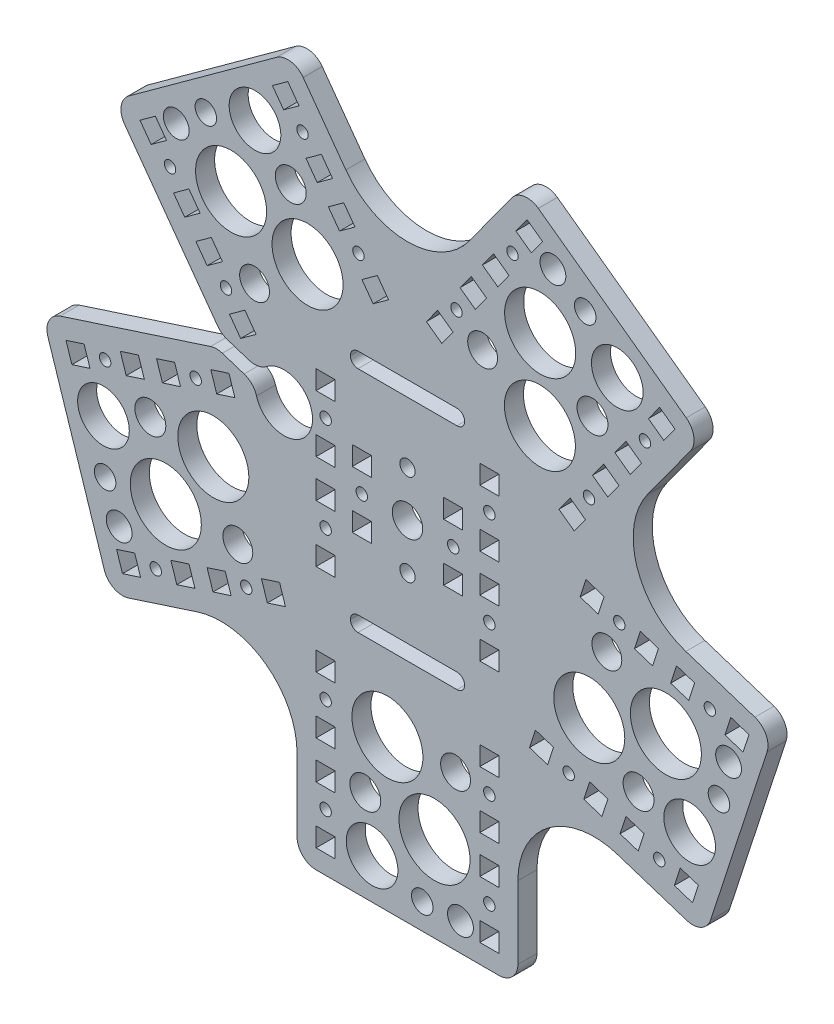
from build123d import *

# Parameters (mm, degrees)
ESQUISSE1_R        = 4
ESQUISSE1_R_2      = 2
ESQUISSE1_R_3      = 9.330569086
ESQUISSE1_R_4      = 6.785078522
ESQUISSE1_R_5      = 4.062418715
ESQUISSE1_R_6      = 3.923995784
ESQUISSE1_R_7      = 2.830029206
ESQUISSE1_R_8      = 3.391581878
ESQUISSE1_R_9      = 1.5
ESQUISSE1_W        = 30
ESQUISSE1_H        = 4
ESQUISSE1_W_2      = 5
ESQUISSE1_H_2      = 5
BOSS_EXTRU_1_DEPTH = 5
CONG_1_R           = 2
CONG_2_R           = 20
CONG_3_R           = 5


with BuildPart() as part:
    # Esquisse1 → Boss.-Extru.1 (new body)
    with BuildSketch(Plane.XY):
        with BuildLine():
            Line((-29, -91.5), (29, -91.5))
            Line((29, -91.5), (29, -39.915075694))
            Line((29, -39.915075694), (78.060178404, -55.855693958))
            Line((78.060178404, -55.855693958), (95.983164078, -0.694416013))
            Line((95.983164078, -0.694416013), (46.922985674, 15.246202251))
            Line((46.922985674, 15.246202251), (77.243843422, 56.979282669))
            Line((77.243843422, 56.979282669), (30.320857748, 91.070827302))
            Line((30.320857748, 91.070827302), (0, 49.337746884))
            Line((0, 49.337746884), (-30.320857748, 91.070827302))
            Line((-30.320857748, 91.070827302), (-77.243843422, 56.979282669))
            Line((-77.243843422, 56.979282669), (-48.922985674, 17.998966092))
            Line((-48.922985674, 17.998966092), (-38.696499555, 14.676179329))
            ThreePointArc((-38.696499555, 14.676179329), (-25.306977392, 8.222735407), (-39.932567532, 10.871953264))
            Line((-39.932567532, 10.871953264), (-50.159053651, 14.194740027))
            Line((-50.159053651, 14.194740027), (-95.983164078, -0.694416013))
            Line((-95.983164078, -0.694416013), (-78.060178404, -55.855693958))
            Line((-78.060178404, -55.855693958), (-29, -39.915075694))
            Line((-29, -39.915075694), (-29, -91.5))
        make_face()
        Circle(ESQUISSE1_R, mode=Mode.SUBTRACT)
        with Locations((0, -12)):
            Circle(ESQUISSE1_R_2, mode=Mode.SUBTRACT)
        with Locations((0, 12)):
            Circle(ESQUISSE1_R_2, mode=Mode.SUBTRACT)
        with Locations((-5.271266867, -51.905701943)):
            Circle(ESQUISSE1_R_3, mode=Mode.SUBTRACT)
        with Locations((7.090608048, -69.04841246)):
            Circle(ESQUISSE1_R_3, mode=Mode.SUBTRACT)
        with Locations((-9.300828303, -80.932203815)):
            Circle(ESQUISSE1_R_4, mode=Mode.SUBTRACT)
        with Locations((-11.076567241, -67.409268825)):
            Circle(ESQUISSE1_R_5, mode=Mode.SUBTRACT)
        with Locations((12.622717816, -50.949534823)):
            Circle(ESQUISSE1_R_6, mode=Mode.SUBTRACT)
        with Locations((3.880618429, -84.756872296)):
            Circle(ESQUISSE1_R_7, mode=Mode.SUBTRACT)
        with Locations((13.920373194, -84.142193433)):
            Circle(ESQUISSE1_R_8, mode=Mode.SUBTRACT)
        with Locations((-75.722349475, -39.24042935)):
            Circle(ESQUISSE1_R_8, mode=Mode.SUBTRACT)
        with Locations((-79.409398655, -29.882001374)):
            Circle(ESQUISSE1_R_7, mode=Mode.SUBTRACT)
        with Locations((-79.845213823, -16.163813006)):
            Circle(ESQUISSE1_R_4, mode=Mode.SUBTRACT)
        with Locations((-67.532871892, -10.296168192)):
            Circle(ESQUISSE1_R_5, mode=Mode.SUBTRACT)
        with Locations((-50.99416711, -11.026471302)):
            Circle(ESQUISSE1_R_3, mode=Mode.SUBTRACT)
        with Locations((-44.555252775, -27.749190148)):
            Circle(ESQUISSE1_R_6, mode=Mode.SUBTRACT)
        with Locations((-63.477824223, -28.080701873)):
            Circle(ESQUISSE1_R_3, mode=Mode.SUBTRACT)
        with Locations((-60.719358878, 59.890274362)):
            Circle(ESQUISSE1_R_8, mode=Mode.SUBTRACT)
        with Locations((-52.958325824, 66.288779796)):
            Circle(ESQUISSE1_R_7, mode=Mode.SUBTRACT)
        with Locations((-40.046227679, 70.942417989)):
            Circle(ESQUISSE1_R_4, mode=Mode.SUBTRACT)
        with Locations((-30.661042946, 61.045886928)):
            Circle(ESQUISSE1_R_5, mode=Mode.SUBTRACT)
        with Locations((-26.244861635, 45.090967902)):
            Circle(ESQUISSE1_R_3, mode=Mode.SUBTRACT)
        with Locations((-40.159378408, 33.799592151)):
            Circle(ESQUISSE1_R_6, mode=Mode.SUBTRACT)
        with Locations((-46.322060949, 51.693584275)):
            Circle(ESQUISSE1_R_3, mode=Mode.SUBTRACT)
        with Locations((38.195721914, 76.254654501)):
            Circle(ESQUISSE1_R_8, mode=Mode.SUBTRACT)
        with Locations((46.679353309, 70.85072036)):
            Circle(ESQUISSE1_R_7, mode=Mode.SUBTRACT)
        with Locations((55.095283997, 60.008638567)):
            Circle(ESQUISSE1_R_4, mode=Mode.SUBTRACT)
        with Locations((48.583305221, 48.024601187)):
            Circle(ESQUISSE1_R_5, mode=Mode.SUBTRACT)
        with Locations((34.773950589, 38.894222052)):
            Circle(ESQUISSE1_R_3, mode=Mode.SUBTRACT)
        with Locations((19.735391951, 48.638486903)):
            Circle(ESQUISSE1_R_6, mode=Mode.SUBTRACT)
        with Locations((34.849216127, 60.029093955)):
            Circle(ESQUISSE1_R_3, mode=Mode.SUBTRACT)
        with Locations((84.325613245, -12.76230608)):
            Circle(ESQUISSE1_R_8, mode=Mode.SUBTRACT)
        with Locations((81.807752742, -22.500626486)):
            Circle(ESQUISSE1_R_7, mode=Mode.SUBTRACT)
        with Locations((74.096985808, -33.855039736)):
            Circle(ESQUISSE1_R_4, mode=Mode.SUBTRACT)
        with Locations((60.687176858, -31.365051098)):
            Circle(ESQUISSE1_R_5, mode=Mode.SUBTRACT)
        with Locations((47.736345022, -21.053016708)):
            Circle(ESQUISSE1_R_3, mode=Mode.SUBTRACT)
        with Locations((52.356521416, -3.739354083)):
            Circle(ESQUISSE1_R_6, mode=Mode.SUBTRACT)
        with Locations((67.860060997, -14.593563897)):
            Circle(ESQUISSE1_R_3, mode=Mode.SUBTRACT)
        with Locations(Location((-21.5, -76.5, 0), (0, 0, 180))):
            Circle(ESQUISSE1_R_9, mode=Mode.SUBTRACT)
        with Locations(Location((-21.5, -51.5, 0), (0, 0, 270))):
            Circle(ESQUISSE1_R_9, mode=Mode.SUBTRACT)
        with Locations(Location((21.5, -51.5, 0), (0, 0, 90))):
            Circle(ESQUISSE1_R_9, mode=Mode.SUBTRACT)
        with Locations((21.5, -76.5)):
            Circle(ESQUISSE1_R_9, mode=Mode.SUBTRACT)
        with Locations(Location((-79.399688876, -3.192084969, 0), (0, 0, 90))):
            Circle(ESQUISSE1_R_9, mode=Mode.SUBTRACT)
        with Locations(Location((-55.623275968, 4.53333989, 0), (0, 0, 270))):
            Circle(ESQUISSE1_R_9, mode=Mode.SUBTRACT)
        with Locations(Location((-42.33554521, -36.362090311, 0), (0, 0, 180))):
            Circle(ESQUISSE1_R_9, mode=Mode.SUBTRACT)
        with Locations((-66.111958118, -44.08751517)):
            Circle(ESQUISSE1_R_9, mode=Mode.SUBTRACT)
        with Locations(Location((-27.571706421, 74.527182994, 0), (0, 0, 180))):
            Circle(ESQUISSE1_R_9, mode=Mode.SUBTRACT)
        with Locations((-12.877075114, 54.301758135)):
            Circle(ESQUISSE1_R_9, mode=Mode.SUBTRACT)
        with Locations(Location((-47.664805872, 29.026992286, 0), (0, 0, 90))):
            Circle(ESQUISSE1_R_9, mode=Mode.SUBTRACT)
        with Locations((-62.359437179, 49.252417145)):
            Circle(ESQUISSE1_R_9, mode=Mode.SUBTRACT)
        with Locations(Location((62.359437179, 49.252417145, 0), (0, 0, 180))):
            Circle(ESQUISSE1_R_9, mode=Mode.SUBTRACT)
        with Locations(Location((47.664805872, 29.026992286, 0), (0, 0, 270))):
            Circle(ESQUISSE1_R_9, mode=Mode.SUBTRACT)
        with Locations(Location((12.877075114, 54.301758135, 0), (0, 0, 90))):
            Circle(ESQUISSE1_R_9, mode=Mode.SUBTRACT)
        with Locations((27.571706421, 74.527182994)):
            Circle(ESQUISSE1_R_9, mode=Mode.SUBTRACT)
        with Locations(Location((66.111958118, -44.08751517, 0), (0, 0, 90))):
            Circle(ESQUISSE1_R_9, mode=Mode.SUBTRACT)
        with Locations((42.33554521, -36.362090311)):
            Circle(ESQUISSE1_R_9, mode=Mode.SUBTRACT)
        with Locations(Location((55.623275968, 4.53333989, 0), (0, 0, 180))):
            Circle(ESQUISSE1_R_9, mode=Mode.SUBTRACT)
        with Locations((79.399688876, -3.192084969)):
            Circle(ESQUISSE1_R_9, mode=Mode.SUBTRACT)
        with Locations(Location((-21.5, -12.5, 0), (0, 0, 180))):
            Circle(ESQUISSE1_R_9, mode=Mode.SUBTRACT)
        with Locations(Location((-21.5, 12.5, 0), (0, 0, 270))):
            Circle(ESQUISSE1_R_9, mode=Mode.SUBTRACT)
        with Locations(Location((21.5, 12.5, 0), (0, 0, 90))):
            Circle(ESQUISSE1_R_9, mode=Mode.SUBTRACT)
        with Locations((21.5, -12.5)):
            Circle(ESQUISSE1_R_9, mode=Mode.SUBTRACT)
        with Locations(Location((12, 0, 0), (0, 0, 90))):
            Circle(ESQUISSE1_R_9, mode=Mode.SUBTRACT)
        with Locations(Location((-12, 0, 0), (0, 0, 90))):
            Circle(ESQUISSE1_R_9, mode=Mode.SUBTRACT)
        with Locations((0, -30)):
            Rectangle(ESQUISSE1_W, ESQUISSE1_H, mode=Mode.SUBTRACT)
        with Locations((0, 30)):
            Rectangle(ESQUISSE1_W, ESQUISSE1_H, mode=Mode.SUBTRACT)
        with Locations((-21.5, -69)):
            Rectangle(ESQUISSE1_W_2, ESQUISSE1_H_2, mode=Mode.SUBTRACT)
        with Locations((-21.5, -84)):
            Rectangle(ESQUISSE1_W_2, ESQUISSE1_H_2, mode=Mode.SUBTRACT)
        with Locations((-21.5, -59)):
            Rectangle(ESQUISSE1_W_2, ESQUISSE1_H_2, mode=Mode.SUBTRACT)
        with Locations((-21.5, -44)):
            Rectangle(ESQUISSE1_W_2, ESQUISSE1_H_2, mode=Mode.SUBTRACT)
        with Locations((21.5, -59)):
            Rectangle(ESQUISSE1_W_2, ESQUISSE1_H_2, mode=Mode.SUBTRACT)
        with Locations((21.5, -44)):
            Rectangle(ESQUISSE1_W_2, ESQUISSE1_H_2, mode=Mode.SUBTRACT)
        with Locations((21.5, -69)):
            Rectangle(ESQUISSE1_W_2, ESQUISSE1_H_2, mode=Mode.SUBTRACT)
        with Locations((21.5, -84)):
            Rectangle(ESQUISSE1_W_2, ESQUISSE1_H_2, mode=Mode.SUBTRACT)
        Polygon((-75.41694878, 0.730641293), (-70.661666199, 2.275726265), (-69.116581227, -2.479556316), (-73.871863808, -4.024641288), align=None, mode=Mode.SUBTRACT)
        Polygon((-84.927513943, -2.35952865), (-89.682796525, -3.904613622), (-88.137711553, -8.659896204), (-83.382428971, -7.114811232), align=None, mode=Mode.SUBTRACT)
        Polygon((-61.151101036, 5.365896209), (-65.906383617, 3.820811237), (-64.361298645, -0.934471344), (-59.606016064, 0.610613627), align=None, mode=Mode.SUBTRACT)
        Polygon((-51.640535873, 8.456066153), (-46.885253291, 10.001151125), (-45.340168319, 5.245868543), (-50.095450901, 3.700783571), align=None, mode=Mode.SUBTRACT)
        Polygon((-46.318285306, -40.284816573), (-51.073567887, -41.829901545), (-52.618652859, -37.074618964), (-47.863370278, -35.529533992), align=None, mode=Mode.SUBTRACT)
        Polygon((-36.807720143, -37.19464663), (-32.052437561, -35.649561658), (-33.597522533, -30.894279076), (-38.352805115, -32.439364048), align=None, mode=Mode.SUBTRACT)
        Polygon((-60.58413305, -44.920071489), (-55.828850469, -43.374986517), (-57.373935441, -38.619703936), (-62.129218022, -40.164788907), align=None, mode=Mode.SUBTRACT)
        Polygon((-70.094698213, -48.010241433), (-74.849980795, -49.555326405), (-76.395065766, -44.800043823), (-71.639783185, -43.254958851), align=None, mode=Mode.SUBTRACT)
        Polygon((-22.610237674, 71.951561153), (-19.671311412, 67.906476181), (-23.716396384, 64.967549919), (-26.655322646, 69.012634891), align=None, mode=Mode.SUBTRACT)
        Polygon((-28.488090197, 80.041731097), (-31.427016458, 84.086816068), (-35.47210143, 81.147889807), (-32.533175169, 77.102804835), align=None, mode=Mode.SUBTRACT)
        Polygon((-13.79345889, 59.816306237), (-16.732385151, 63.861391209), (-20.777470123, 60.922464948), (-17.838543861, 56.877379976), align=None, mode=Mode.SUBTRACT)
        Polygon((-7.915606367, 51.726136293), (-4.976680105, 47.681051322), (-9.021765077, 44.74212506), (-11.960691338, 48.787210032), align=None, mode=Mode.SUBTRACT)
        Polygon((-52.62627462, 31.602614127), (-55.565200881, 35.647699099), (-51.520115909, 38.58662536), (-48.581189648, 34.541540389), align=None, mode=Mode.SUBTRACT)
        Polygon((-46.748422097, 23.512444183), (-43.809495835, 19.467359212), (-39.764410863, 22.406285473), (-42.703337125, 26.451370445), align=None, mode=Mode.SUBTRACT)
        Polygon((-61.443053404, 43.737869043), (-58.504127142, 39.692784071), (-54.459042171, 42.631710332), (-57.397968432, 46.676795304), align=None, mode=Mode.SUBTRACT)
        Polygon((-67.320905927, 51.828038987), (-70.259832188, 55.873123958), (-66.214747216, 58.81205022), (-63.275820955, 54.766965248), align=None, mode=Mode.SUBTRACT)
        Polygon((61.443053404, 43.737869043), (58.504127142, 39.692784071), (54.459042171, 42.631710332), (57.397968432, 46.676795304), align=None, mode=Mode.SUBTRACT)
        Polygon((67.320905927, 51.828038987), (70.259832188, 55.873123958), (66.214747216, 58.81205022), (63.275820955, 54.766965248), align=None, mode=Mode.SUBTRACT)
        Polygon((52.62627462, 31.602614127), (55.565200881, 35.647699099), (51.520115909, 38.586625361), (48.581189648, 34.541540389), align=None, mode=Mode.SUBTRACT)
        Polygon((46.748422097, 23.512444183), (43.809495835, 19.467359212), (39.764410863, 22.406285473), (42.703337125, 26.451370445), align=None, mode=Mode.SUBTRACT)
        Polygon((13.79345889, 59.816306237), (16.732385151, 63.861391209), (20.777470123, 60.922464948), (17.838543861, 56.877379976), align=None, mode=Mode.SUBTRACT)
        Polygon((7.915606367, 51.726136293), (4.976680105, 47.681051322), (9.021765077, 44.74212506), (11.960691338, 48.787210032), align=None, mode=Mode.SUBTRACT)
        Polygon((22.610237674, 71.951561153), (19.671311412, 67.906476181), (23.716396384, 64.967549919), (26.655322646, 69.012634891), align=None, mode=Mode.SUBTRACT)
        Polygon((28.488090197, 80.041731097), (31.427016458, 84.086816068), (35.47210143, 81.147889807), (32.533175169, 77.102804835), align=None, mode=Mode.SUBTRACT)
        Polygon((60.58413305, -44.920071489), (55.828850469, -43.374986517), (57.373935441, -38.619703936), (62.129218022, -40.164788907), align=None, mode=Mode.SUBTRACT)
        Polygon((70.094698213, -48.010241433), (74.849980795, -49.555326405), (76.395065766, -44.800043823), (71.639783185, -43.254958851), align=None, mode=Mode.SUBTRACT)
        Polygon((46.318285306, -40.284816573), (51.073567887, -41.829901545), (52.618652859, -37.074618964), (47.863370278, -35.529533992), align=None, mode=Mode.SUBTRACT)
        Polygon((36.807720143, -37.19464663), (32.052437561, -35.649561658), (33.597522533, -30.894279076), (38.352805115, -32.439364048), align=None, mode=Mode.SUBTRACT)
        Polygon((61.151101036, 5.365896209), (65.906383617, 3.820811237), (64.361298645, -0.934471344), (59.606016064, 0.610613627), align=None, mode=Mode.SUBTRACT)
        Polygon((51.640535873, 8.456066153), (46.885253291, 10.001151125), (45.340168319, 5.245868543), (50.095450901, 3.700783571), align=None, mode=Mode.SUBTRACT)
        Polygon((75.41694878, 0.730641293), (70.661666199, 2.275726265), (69.116581227, -2.479556316), (73.871863808, -4.024641288), align=None, mode=Mode.SUBTRACT)
        Polygon((84.927513943, -2.35952865), (89.682796525, -3.904613622), (88.137711553, -8.659896204), (83.382428971, -7.114811232), align=None, mode=Mode.SUBTRACT)
        with Locations((-21.5, -5)):
            Rectangle(ESQUISSE1_W_2, ESQUISSE1_H_2, mode=Mode.SUBTRACT)
        with Locations((-21.5, -20)):
            Rectangle(ESQUISSE1_W_2, ESQUISSE1_H_2, mode=Mode.SUBTRACT)
        with Locations((-21.5, 5)):
            Rectangle(ESQUISSE1_W_2, ESQUISSE1_H_2, mode=Mode.SUBTRACT)
        with Locations((-21.5, 20)):
            Rectangle(ESQUISSE1_W_2, ESQUISSE1_H_2, mode=Mode.SUBTRACT)
        with Locations((21.5, 5)):
            Rectangle(ESQUISSE1_W_2, ESQUISSE1_H_2, mode=Mode.SUBTRACT)
        with Locations((21.5, 20)):
            Rectangle(ESQUISSE1_W_2, ESQUISSE1_H_2, mode=Mode.SUBTRACT)
        with Locations((21.5, -5)):
            Rectangle(ESQUISSE1_W_2, ESQUISSE1_H_2, mode=Mode.SUBTRACT)
        with Locations((21.5, -20)):
            Rectangle(ESQUISSE1_W_2, ESQUISSE1_H_2, mode=Mode.SUBTRACT)
        with Locations((12, -7.5)):
            Rectangle(ESQUISSE1_W_2, ESQUISSE1_H_2, mode=Mode.SUBTRACT)
        with Locations((12, 7.5)):
            Rectangle(ESQUISSE1_W_2, ESQUISSE1_H_2, mode=Mode.SUBTRACT)
        with Locations((-12, -7.5)):
            Rectangle(ESQUISSE1_W_2, ESQUISSE1_H_2, mode=Mode.SUBTRACT)
        with Locations((-12, 7.5)):
            Rectangle(ESQUISSE1_W_2, ESQUISSE1_H_2, mode=Mode.SUBTRACT)
    extrude(amount=BOSS_EXTRU_1_DEPTH)

    # Congé1
    cong_1_edges = [part.edges().sort_by_distance(p)[0] for p in [
        (-15, -32, 2.5),
        (-15, -28, 2.5),
        (15, -28, 2.5),
        (15, -32, 2.5),
        (15, 28, 2.5),
        (15, 32, 2.5),
        (-15, 28, 2.5),
        (-15, 32, 2.5),
    ]]
    fillet(cong_1_edges, radius=CONG_1_R - 0.0001)  # a hair under: the kernel refuses the full size

    # Congé2
    cong_2_edges = [part.edges().sort_by_distance(p)[0] for p in [
        (-29, -39.915075694, 2.5),
        (0, 49.337746884, 2.5),
        (46.922985674, 15.246202251, 2.5),
        (29, -39.915075694, 2.5),
    ]]
    fillet(cong_2_edges, radius=CONG_2_R)

    # Congé3
    cong_3_edges = [part.edges().sort_by_distance(p)[0] for p in [
        (-78.060178404, -55.855693958, 2.5),
        (-95.983164078, -0.694416013, 2.5),
        (-50.159053651, 14.194740027, 2.5),
        (-39.932567532, 10.871953264, 2.5),
        (-38.696499555, 14.676179329, 2.5),
        (-48.922985674, 17.998966092, 2.5),
        (-77.243843422, 56.979282669, 2.5),
        (-30.320857748, 91.070827302, 2.5),
        (30.320857748, 91.070827302, 2.5),
        (77.243843422, 56.979282669, 2.5),
        (95.983164078, -0.694416013, 2.5),
        (78.060178404, -55.855693958, 2.5),
        (29, -91.5, 2.5),
        (-29, -91.5, 2.5),
    ]]
    fillet(cong_3_edges, radius=CONG_3_R)


solid = part.part
